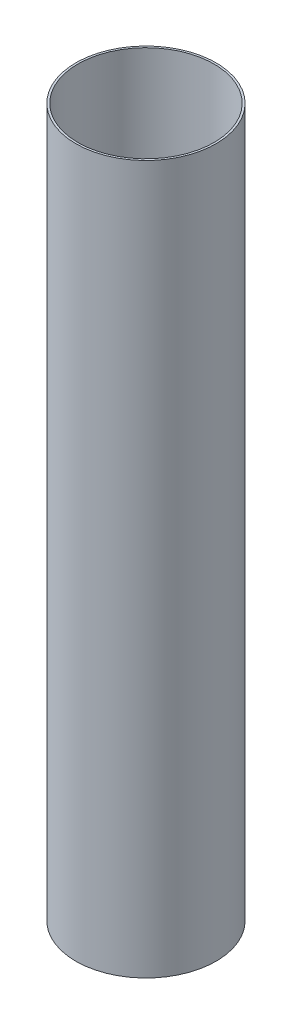
from build123d import *

# Parameters (mm, degrees)
SKETCH1_R           = 65.405
SKETCH1_R_2         = 63.5
BOSS_EXTRUDE1_DEPTH = 330.2


with BuildPart() as part:
    # Sketch1 → Boss-Extrude1 (new, symmetric)
    with BuildSketch(Plane(origin=(0, 0, 0), x_dir=(1, 0, 0), z_dir=(0, 1, 0))):
        Circle(SKETCH1_R)
        Circle(SKETCH1_R_2, mode=Mode.SUBTRACT)
    extrude(amount=BOSS_EXTRUDE1_DEPTH, both=True)


solid = part.part
